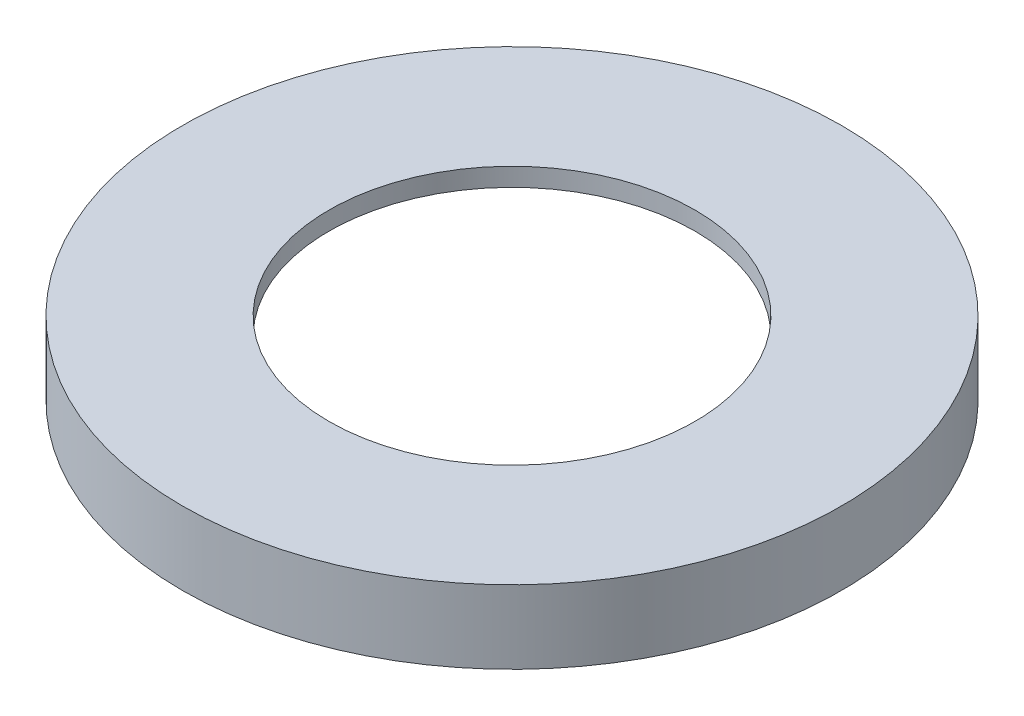
from build123d import *

# Parameters (mm, degrees)
SKETCH1_R           = 18
SKETCH1_R_2         = 15.5
BOSS_EXTRUDE1_DEPTH = 3
SKETCH2_R           = 18
SKETCH2_R_2         = 10
BOSS_EXTRUDE2_DEPTH = 1
THREAD2_PITCH       = 1
THREAD2_TO          = 4


with BuildPart() as part:
    # Sketch1 → Boss-Extrude1 (new body)
    with BuildSketch(Plane(origin=(0, 0, 0), x_dir=(1, 0, 0), z_dir=(0, 1, 0))):
        with Locations(Location((0, 0, 0), (0, 0, 270))):
            Circle(SKETCH1_R)
        with Locations(Location((0, 0, 0), (0, 0, 270))):
            Circle(SKETCH1_R_2, mode=Mode.SUBTRACT)
    extrude(amount=BOSS_EXTRUDE1_DEPTH)

    # Sketch2 → Boss-Extrude2 (add)
    with BuildSketch(Plane(origin=(0, 3, 0), x_dir=(1, 0, 0), z_dir=(0, 1, 0))):
        with Locations(Location((0, 0, 0), (0, 0, 270))):
            Circle(SKETCH2_R)
        with Locations(Location((0, 0, 0), (0, 0, 270))):
            Circle(SKETCH2_R_2, mode=Mode.SUBTRACT)
    extrude(amount=BOSS_EXTRUDE2_DEPTH)

    # Thread2: arcs per turn and ends read off the stored shape
    # Thread2: the profile of Thread Profile2 profile screwed along a right-hand helix through 4 turns, 8 arcs to a turn; built about Z, then put on its axis
    thread2_z = Axis((0, 0, 0), (0, 0, 1))
    thread2_corners = [(15.4997, 0, -0.000173205), (16.041265875, 0, 0.312499999), (16.041265875, 0, 0.437499999), (15.4997, 0, 0.750173202)]
    with BuildLine(mode=Mode.PRIVATE) as thread2_profile:
        Line(thread2_corners[0], thread2_corners[1])
        Line(thread2_corners[1], thread2_corners[2])
        Line(thread2_corners[2], thread2_corners[3])
        Line(thread2_corners[3], thread2_corners[0])
    thread2_cap = Face(thread2_profile.wire())
    thread2_turn_angles = [0, 22.5, 45, 67.5, 90, 112.5, 135, 157.5, 180, 202.5, 225, 247.5, 270, 292.5, 315, 337.5, 360]
    thread2_turn_weights = [1, 0.9238795325112867, 1, 0.9238795325112867, 1, 0.9238795325112867, 1, 0.9238795325112867, 1, 0.9238795325112867, 1, 0.9238795325112867, 1, 0.9238795325112867, 1, 0.9238795325112867, 1]
    thread2_turn_rails = [Edge.make_bspline([Vector(p[0], p[1], 0).rotate(thread2_z, thread2_turn_angles[k]) / thread2_turn_weights[k] + Vector(0, 0, p[2] + THREAD2_PITCH * thread2_turn_angles[k] / 360) for k in range(17)], [0, 0, 0, 1, 1, 2, 2, 3, 3, 4, 4, 5, 5, 6, 6, 7, 7, 8, 8, 8], 2, thread2_turn_weights) for p in thread2_corners]
    thread2_turn_sides = [Face.make_surface_from_curves(thread2_turn_rails[p[0]], thread2_turn_rails[p[1]]) for p in [(0, 1), (1, 2), (2, 3), (3, 0)]]
    thread2 = Plane(origin=(0, -1, 0), x_dir=(1, 0, 0), z_dir=(0, 1, 0)) * split(Solid(Shell([*[p.moved(Location((0, 0, THREAD2_PITCH * i))) for i in range(4) for p in thread2_turn_sides], thread2_cap, thread2_cap.rotate(thread2_z, 1440).moved(Location((0, 0, THREAD2_PITCH * 1440 / 360)))])), bisect_by=Plane.XY.offset(THREAD2_TO), keep=Keep.BOTTOM, mode=Mode.PRIVATE)
    add(thread2, mode=Mode.SUBTRACT)


solid = part.part
